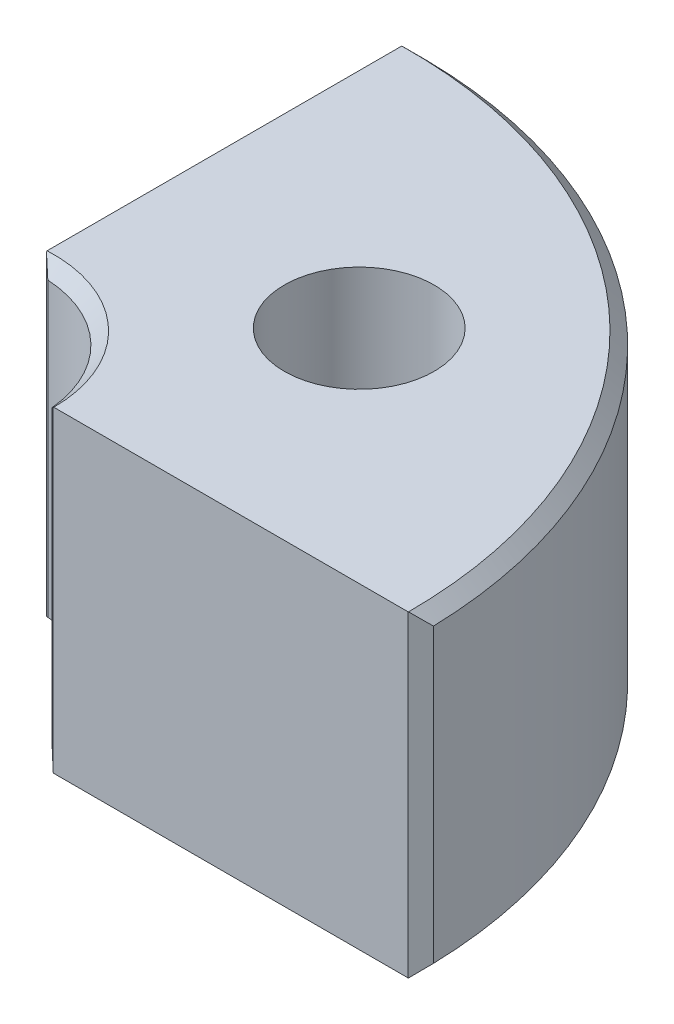
from build123d import *

# Parameters (mm, degrees)
BOSS_EXTRUDE1_DEPTH = 127
SKETCH2_R           = 30
CUT_EXTRUDE1_DEPTH  = 311.046770665
CHAMFER2_START      = -127
CHAMFER2_DEPTH      = 127


with BuildPart() as part:
    # Sketch1 → Boss-Extrude1 (new body)
    with BuildSketch(Plane(origin=(0, 0, 0), x_dir=(1, 0, 0), z_dir=(0, 1, 0))):
        with BuildLine():
            Line((48, 0), (200, 0))
            ThreePointArc((200, 0), (140.492634639, 142.344018533), (-2.618196121, 199.982861888))
            Line((-2.618196121, 199.982861888), (-2.618196121, 47.92854107))
            ThreePointArc((-2.618196121, 47.92854107), (33.002474045, 34.854507698), (48, 0))
        make_face()
    extrude(amount=-BOSS_EXTRUDE1_DEPTH)

    # Sketch2 → Cut-Extrude1 (cut, through all)
    with BuildSketch(Plane(origin=(0, 0, 0), x_dir=(1, 0, 0), z_dir=(0, 1, 0))):
        with Locations(Location((86.738855642, 88.590303092, 0), (0, 0, 270))):
            Circle(SKETCH2_R)
    extrude(amount=-CUT_EXTRUDE1_DEPTH, mode=Mode.SUBTRACT)

    # Chamfer2: read off the stored shape, not the designer's step
    # Chamfer2 outline → Chamfer2 (cut)
    with BuildSketch(Plane(origin=(0, 0, 0), x_dir=(1, 0, 0), z_dir=(0, 1, 0)).offset(CHAMFER2_START)):
        with BuildLine():
            ThreePointArc((200, 0), (199.983560067, 2.56431335), (199.93424297, 5.128205128))
            Line((199.93424297, 5.128205128), (194.935886896, 0))
            Line((194.935886896, 0), (200, 0))
        make_face()
        with BuildLine():
            Line((-2.618196121, 194.982861888), (2.384724212, 199.98578222))
            ThreePointArc((2.384724212, 199.98578222), (-0.116745086, 199.999965926), (-2.618196121, 199.982861888))
            Line((-2.618196121, 199.982861888), (-2.618196121, 194.982861888))
        make_face()
        with BuildLine():
            Line((48, 0), (52.763623833, 0))
            Line((52.763623833, 0), (47.785923471, 4.528301887))
            ThreePointArc((47.785923471, 4.528301887), (47.946450998, 2.266679661), (48, 0))
        make_face()
        with BuildLine():
            Line((2.682579438, 47.924980621), (-2.618196121, 52.676622021))
            Line((-2.618196121, 52.676622021), (-2.618196121, 47.92854107))
            ThreePointArc((-2.618196121, 47.92854107), (0.032240845, 47.999989172), (2.682579438, 47.924980621))
        make_face()
    extrude(amount=CHAMFER2_DEPTH, mode=Mode.SUBTRACT)

    # Chamfer2 2 outline → Chamfer2 2 (revolve, cut)
    with BuildSketch(Plane.XY):
        Polygon((200, -122), (195, -127), (200, -127), align=None)
        Polygon((48, -127), (53, -127), (48, -122), align=None)
        Polygon((195, 0), (200, -5), (200, 0), align=None)
        Polygon((48, 0), (48, -5), (53, 0), align=None)
    revolve(axis=Axis((0, 0, 0), (0, 1, 0)), mode=Mode.SUBTRACT)


solid = part.part
